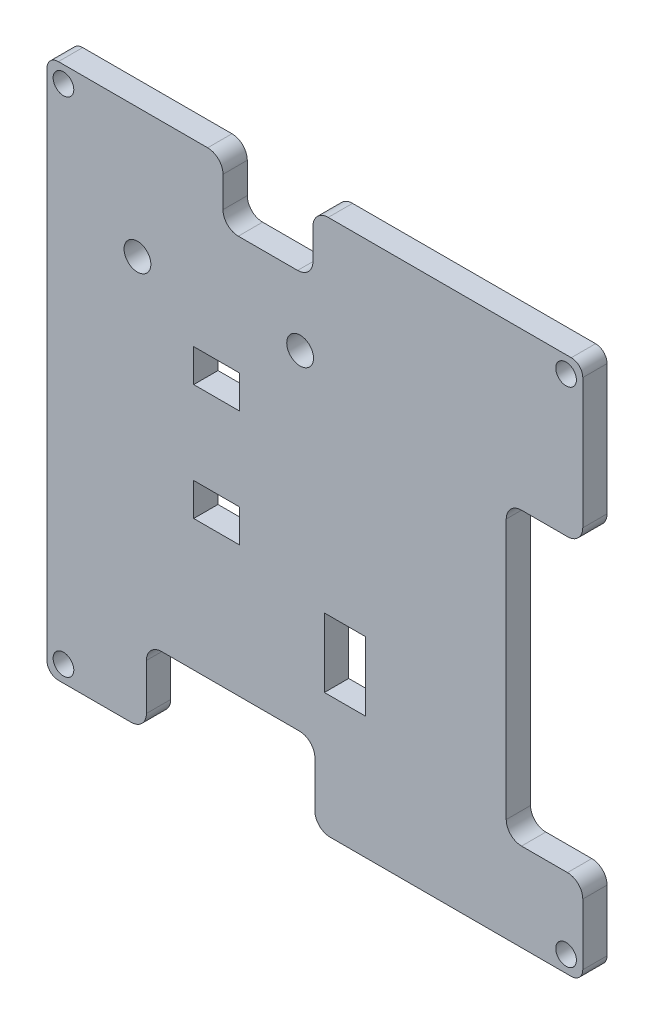
from build123d import *

# Parameters (mm, degrees)
SKETCH1_W               = 70
SKETCH1_H               = 70
SKETCH1_R               = 1.35
BOSS_EXTRUDE1_DEPTH     = 3.175
FILLET1_R               = 1.5
CUT_EXTRUDE1_DEPTH      = 50.599199842
CUT_EXTRUDE1_DEPTH_BACK = 50.599199842
SKETCH2_W               = 10
SKETCH2_H               = 38
FILLET2_R               = 2
CUT_EXTRUDE2_DEPTH      = 50.599199842
CUT_EXTRUDE2_DEPTH_BACK = 50.599199842
SKETCH3_W               = 22
SKETCH3_H               = 10
SKETCH3_W_2             = 11.75
SKETCH3_H_2             = 8
SKETCH3_W_3             = 5.35
SKETCH3_H_3             = 9
FILLET3_R               = 2
CUT_EXTRUDE3_DEPTH      = 50.599199842
CUT_EXTRUDE3_DEPTH_BACK = 50.599199842
SKETCH4_R               = 1.75
SKETCH4_W               = 6
SKETCH4_H               = 4.3


with BuildPart() as part:
    # Sketch1 → Boss-Extrude1 (new body)
    with BuildSketch(Plane.XY):
        Rectangle(SKETCH1_W, SKETCH1_H)
        with Locations((-32.84, 32.82)):
            Circle(SKETCH1_R, mode=Mode.SUBTRACT)
        with Locations((-32.84, -32.84)):
            Circle(SKETCH1_R, mode=Mode.SUBTRACT)
        with Locations((32.82, -32.84)):
            Circle(SKETCH1_R, mode=Mode.SUBTRACT)
        with Locations((32.82, 32.82)):
            Circle(SKETCH1_R, mode=Mode.SUBTRACT)
    extrude(amount=BOSS_EXTRUDE1_DEPTH)

    # Fillet1
    fillet1_edges = [part.edges().sort_by_distance(p)[0] for p in [
        (35, 35, 1.5875),
        (35, -35, 1.5875),
        (-35, -35, 1.5875),
        (-35, 35, 1.5875),
    ]]
    fillet(fillet1_edges, radius=FILLET1_R)

    # Sketch2 → Cut-Extrude1 (cut, two sides: drawn at the far end of the back side and taken through both)
    with BuildSketch(Plane(origin=(0, 0, 0), x_dir=(-1, 0, 0), z_dir=(0, 0, -1)).offset(-CUT_EXTRUDE1_DEPTH_BACK)):
        with Locations((-30, -4.5)):
            Rectangle(SKETCH2_W, SKETCH2_H)
    extrude(amount=CUT_EXTRUDE1_DEPTH + CUT_EXTRUDE1_DEPTH_BACK, mode=Mode.SUBTRACT)

    # Fillet2
    fillet2_edges = [part.edges().sort_by_distance(p)[0] for p in [
        (35, -23.5, 1.5875),
        (35, 14.5, 1.5875),
        (25, 14.5, 1.5875),
        (25, -23.5, 1.5875),
    ]]
    fillet(fillet2_edges, radius=FILLET2_R)

    # Sketch3 → Cut-Extrude2 (cut, two sides: drawn at the far end of the back side and taken through both)
    with BuildSketch(Plane(origin=(0, 0, 0), x_dir=(-1, 0, 0), z_dir=(0, 0, -1)).offset(-CUT_EXTRUDE2_DEPTH_BACK)):
        with Locations((11, -30)):
            Rectangle(SKETCH3_W, SKETCH3_H)
        with Locations((6.125, 31)):
            Rectangle(SKETCH3_W_2, SKETCH3_H_2)
        with Locations((-3.925, -14.5)):
            Rectangle(SKETCH3_W_3, SKETCH3_H_3)
    extrude(amount=CUT_EXTRUDE2_DEPTH + CUT_EXTRUDE2_DEPTH_BACK, mode=Mode.SUBTRACT)

    # Fillet3
    fillet3_edges = [part.edges().sort_by_distance(p)[0] for p in [
        (0, -35, 1.5875),
        (-22, -35, 1.5875),
        (-22, -25, 1.5875),
        (0, -25, 1.5875),
        (-12, 27, 1.5875),
        (-0.25, 27, 1.5875),
        (-0.25, 35, 1.5875),
        (-12, 35, 1.5875),
    ]]
    fillet(fillet3_edges, radius=FILLET3_R)

    # Sketch4 → Cut-Extrude3 (cut, two sides: drawn at the far end of the back side and taken through both)
    with BuildSketch(Plane(origin=(0, 0, 0), x_dir=(-1, 0, 0), z_dir=(0, 0, -1)).offset(-CUT_EXTRUDE3_DEPTH_BACK)):
        with Locations((23.174027153, 18.096571766)):
            Circle(SKETCH4_R)
        with Locations((1.924027153, 18.096571766)):
            Circle(SKETCH4_R)
        with Locations((12.824027153, 9.446571766)):
            Rectangle(SKETCH4_W, SKETCH4_H)
        with Locations((12.824027153, -5.703428234)):
            Rectangle(SKETCH4_W, SKETCH4_H)
    extrude(amount=CUT_EXTRUDE3_DEPTH + CUT_EXTRUDE3_DEPTH_BACK, mode=Mode.SUBTRACT)


solid = part.part
